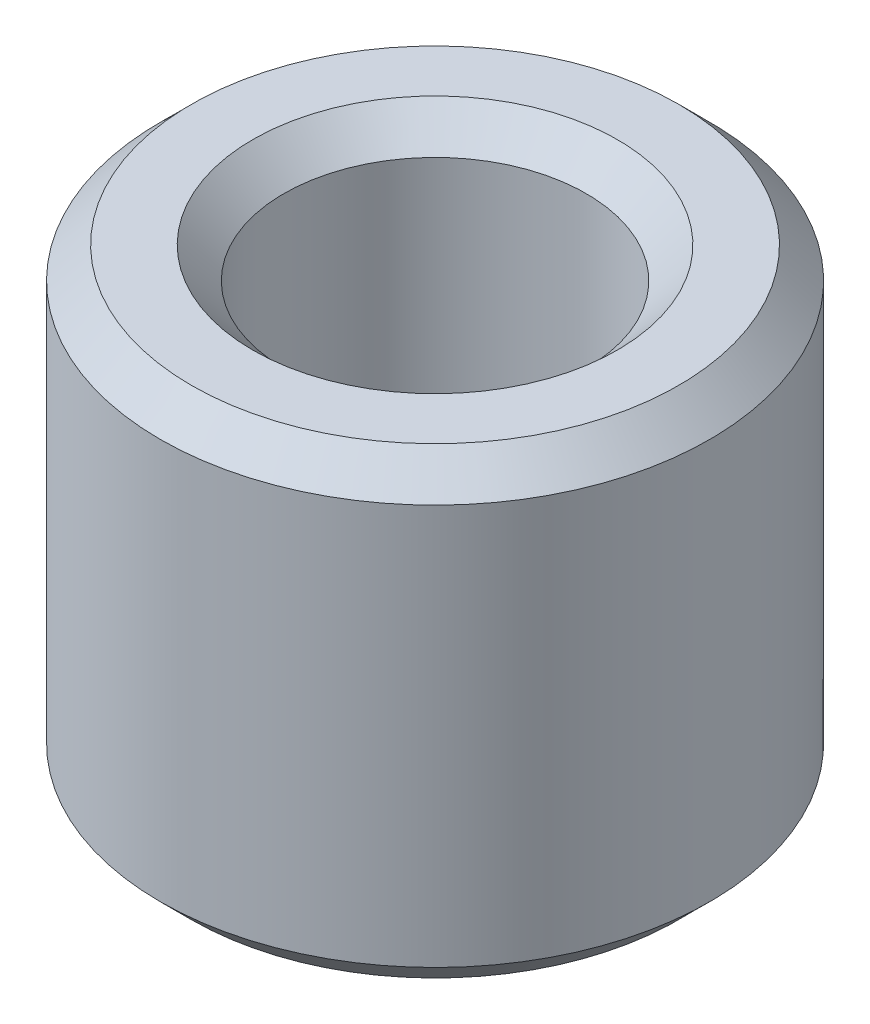
from build123d import *

# Parameters (mm, degrees)
SKETCH1_R           = 22.5
BOSS_EXTRUDE1_DEPTH = 37.896251987
SKETCH2_R           = 12.380043205
CUT_EXTRUDE1_DEPTH  = 50.483592379
CHAMFER1_SIZE       = 2.552910425


with BuildPart() as part:
    # Sketch1 → Boss-Extrude1 (new body)
    with BuildSketch(Plane(origin=(0, 0, 0), x_dir=(1, 0, 0), z_dir=(0, 1, 0))):
        Circle(SKETCH1_R)
    extrude(amount=BOSS_EXTRUDE1_DEPTH)

    # Sketch2 → Cut-Extrude1 (cut, through all)
    with BuildSketch(Plane(origin=(0, 0, 0), x_dir=(1, 0, 0), z_dir=(0, 1, 0))):
        Circle(SKETCH2_R)
    extrude(amount=CUT_EXTRUDE1_DEPTH, mode=Mode.SUBTRACT)

    # Chamfer1
    chamfer1_edges = [part.edges().sort_by_distance(p)[0] for p in [
        (-12.380043205, 37.896251987, 0),
        (-12.380043205, 0, 0),
        (-22.5, 0, 0),
        (-22.5, 37.896251987, 0),
    ]]
    chamfer(chamfer1_edges, length=CHAMFER1_SIZE)


solid = part.part
